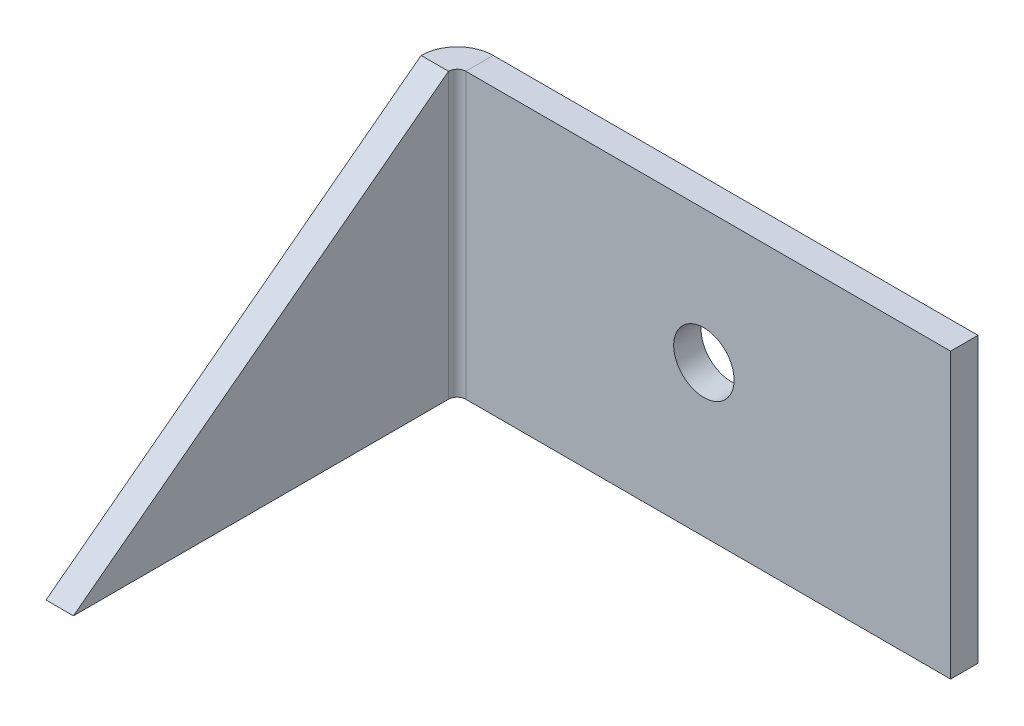
from build123d import *

# Parameters (mm, degrees)
SKETCH2_W                    = 57.15
SKETCH2_H                    = 34.925
BASE_FLANGE1_DEPTH           = 3.175
SKETCH23_W                   = 57.15
SKETCH23_H                   = 2.02438
CUT_EXTRUDE3_DEPTH           = 34.638521909
M6_CLEARANCE_HOLE1_D         = 7
EDGE_FLANGE2_STRIP_W         = 14.7
EDGE_FLANGE2_STRIP_H         = 3.175
EDGE_FLANGE2_STRIP_CUT_DEPTH = 32.90062
EDGE_FLANGE2_DEPTH           = 32.90062
CUT_EXTRUDE2_DEPTH           = 79.817416579


# Sheet-metal steps are written as plain solids
with BuildPart() as part:
    # Sketch2 → Base-Flange1 (new body)
    with BuildSketch(Plane.XY):
        Rectangle(SKETCH2_W, SKETCH2_H)
    extrude(amount=BASE_FLANGE1_DEPTH)

    # Sketch23 → Cut-Extrude3 (cut, through all)
    with BuildSketch(Plane.XY.offset(3.175)):
        with Locations((0, 16.45031)):
            Rectangle(SKETCH23_W, SKETCH23_H)
    extrude(amount=-CUT_EXTRUDE3_DEPTH, mode=Mode.SUBTRACT)

    # M6 Clearance Hole1 (through all)
    with Locations(Plane.XY.offset(3.175)):
        with Locations((0, 0)):
            Hole(M6_CLEARANCE_HOLE1_D / 2)

    # Edge-Flange2 strip (across the edge) → Edge-Flange2 strip cut (cut)
    with BuildSketch(Plane(origin=(-28.575, 15.43812, 3.175), x_dir=(1, 0, 0), z_dir=(0, -1, 0))):
        with Locations((-6.35, -1.5875)):
            Rectangle(EDGE_FLANGE2_STRIP_W, EDGE_FLANGE2_STRIP_H)
    extrude(amount=EDGE_FLANGE2_STRIP_CUT_DEPTH, mode=Mode.SUBTRACT)

    # Edge-Flange2 section (across the edge) → Edge-Flange2 (add)
    with BuildSketch(Plane(origin=(-28.575, 15.43812, 3.175), x_dir=(1, 0, 0), z_dir=(0, -1, 0))):
        with BuildLine():
            Line((-3.175, 1), (-3.175, 44.45))
            Line((-3.175, 44.45), (0, 44.45))
            Line((0, 44.45), (0, 1))
            ThreePointArc((0, 1), (0.292893219, 0.292893219), (1, 0))
            Line((1, 0), (1, -3.175))
            ThreePointArc((1, -3.175), (-1.952170811, -1.952170811), (-3.175, 1))
        make_face()
    extrude(amount=EDGE_FLANGE2_DEPTH)

    # Sketch20 → Cut-Extrude2 (cut, through all)
    with BuildSketch(Plane.ZY.offset(31.75)):
        Polygon((4.175, 15.43812), (47.625, -17.4625), (47.625, 15.43812), align=None)
    extrude(amount=-CUT_EXTRUDE2_DEPTH, mode=Mode.SUBTRACT)


solid = part.part
